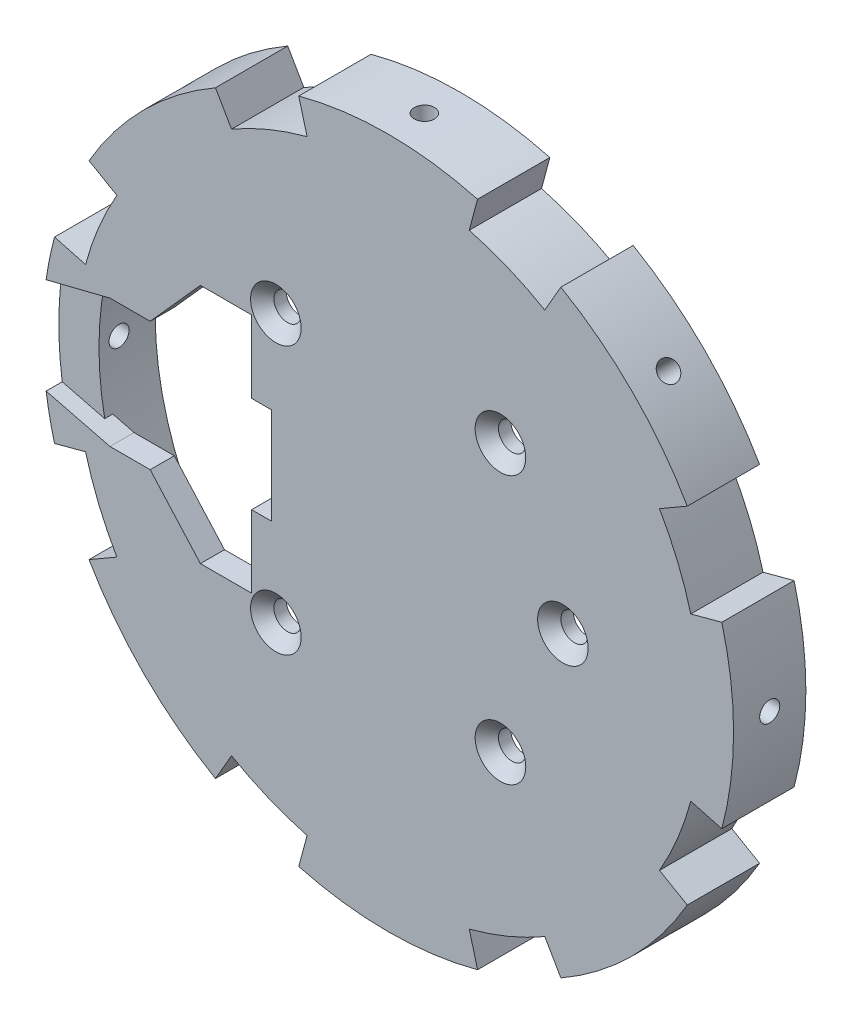
from build123d import *

# Parameters (mm, degrees)
SKETCH_1_R                   = 38
EXTRUDE_1_DEPTH              = 6
EXTRUDE_START                = 3
EXTRUDE_2_DEPTH              = 3
HOLE_WIZARD_M3_1_D           = 3.4
HOLE_WIZARD_M3_1_CSINK_D     = 6.3
HOLE_WIZARD_M3_1_CSINK_ANGLE = 90
M3X0_5_1_D                   = 2.5
M3X0_5_1_ON_FACE_2_D         = 2.5
M3X0_5_1_ON_FACE_3_D         = 2.5
M3X0_5_1_ON_FACE_4_D         = 2.5
M3X0_5_1_ON_FACE_5_D         = 2.5
M3X0_5_1_ON_FACE_6_D         = 2.5
M3X0_5_1_ON_FACE_7_D         = 2.5
M3X0_5_1_ON_FACE_8_D         = 2.5
CUT_EXTRUDE_START            = 3
CUT_EXTRUDE_1_DEPTH          = 3
EXTRUDE_START_2              = 1
EXTRUDE_3_DEPTH              = 1


with BuildPart() as part:
    # 草图1 → 凸台-拉伸1 (new body)
    with BuildSketch(Plane.XY):
        with BuildLine():
            Line((21.5, 37.239092363), (19.5, 33.774990748))
            ThreePointArc((19.5, 33.774990748), (14.924653862, 36.031301768), (10.093942759, 37.671107225))
            Line((10.093942759, 37.671107225), (11.129218939, 41.53481053))
            ThreePointArc((11.129218939, 41.53481053), (5.612626265, 42.632129039), (0, 43))
            ThreePointArc((0, 43), (-5.612626265, 42.632129039), (-11.129218939, 41.53481053))
            Line((-11.129218939, 41.53481053), (-10.093942759, 37.671107225))
            ThreePointArc((-10.093942759, 37.671107225), (-14.924653862, 36.031301768), (-19.5, 33.774990748))
            Line((-19.5, 33.774990748), (-21.5, 37.239092363))
            ThreePointArc((-21.5, 37.239092363), (-26.176741447, 34.114193633), (-30.405591591, 30.405591591))
            ThreePointArc((-30.405591591, 30.405591591), (-34.114193633, 26.176741447), (-37.239092363, 21.5))
            Line((-37.239092363, 21.5), (-33.774990748, 19.5))
            ThreePointArc((-33.774990748, 19.5), (-36.031301768, 14.924653862), (-37.671107225, 10.093942759))
            Line((-37.671107225, 10.093942759), (-41.53481053, 11.129218939))
            ThreePointArc((-41.53481053, 11.129218939), (-42.632129039, 5.612626265), (-43, 0))
            ThreePointArc((-43, 0), (-42.632129039, -5.612626265), (-41.53481053, -11.129218939))
            Line((-41.53481053, -11.129218939), (-37.671107225, -10.093942759))
            ThreePointArc((-37.671107225, -10.093942759), (-36.031301768, -14.924653862), (-33.774990748, -19.5))
            Line((-33.774990748, -19.5), (-37.239092363, -21.5))
            ThreePointArc((-37.239092363, -21.5), (-34.114193633, -26.176741447), (-30.405591591, -30.405591591))
            ThreePointArc((-30.405591591, -30.405591591), (-26.176741447, -34.114193633), (-21.5, -37.239092363))
            Line((-21.5, -37.239092363), (-19.5, -33.774990748))
            ThreePointArc((-19.5, -33.774990748), (-14.924653862, -36.031301768), (-10.093942759, -37.671107225))
            Line((-10.093942759, -37.671107225), (-11.129218939, -41.53481053))
            ThreePointArc((-11.129218939, -41.53481053), (-5.612626265, -42.632129039), (0, -43))
            ThreePointArc((0, -43), (5.612626265, -42.632129039), (11.129218939, -41.53481053))
            Line((11.129218939, -41.53481053), (10.093942759, -37.671107225))
            ThreePointArc((10.093942759, -37.671107225), (14.924653862, -36.031301768), (19.5, -33.774990748))
            Line((19.5, -33.774990748), (21.5, -37.239092363))
            ThreePointArc((21.5, -37.239092363), (26.176741447, -34.114193633), (30.405591591, -30.405591591))
            ThreePointArc((30.405591591, -30.405591591), (34.114193633, -26.176741447), (37.239092363, -21.5))
            Line((37.239092363, -21.5), (33.774990748, -19.5))
            ThreePointArc((33.774990748, -19.5), (36.031301768, -14.924653862), (37.671107225, -10.093942759))
            Line((37.671107225, -10.093942759), (41.53481053, -11.129218939))
            ThreePointArc((41.53481053, -11.129218939), (42.632129039, -5.612626265), (43, 0))
            ThreePointArc((43, 0), (42.632129039, 5.612626265), (41.53481053, 11.129218939))
            Line((41.53481053, 11.129218939), (37.671107225, 10.093942759))
            ThreePointArc((37.671107225, 10.093942759), (36.031301768, 14.924653862), (33.774990748, 19.5))
            Line((33.774990748, 19.5), (37.239092363, 21.5))
            ThreePointArc((37.239092363, 21.5), (34.114193633, 26.176741447), (30.405591591, 30.405591591))
            ThreePointArc((30.405591591, 30.405591591), (26.176741447, 34.114193633), (21.5, 37.239092363))
        make_face()
        Circle(SKETCH_1_R, mode=Mode.SUBTRACT)
    extrude(amount=-EXTRUDE_1_DEPTH)

    # 草图2 → 凸台-拉伸2 (add)
    with BuildSketch(Plane.XY.offset(EXTRUDE_START)):
        with BuildLine():
            Line((-11.129218939, 41.53481053), (-10.093942759, 37.671107225))
            ThreePointArc((-10.093942759, 37.671107225), (-14.924653862, 36.031301768), (-19.5, 33.774990748))
            Line((-19.5, 33.774990748), (-21.5, 37.239092363))
            ThreePointArc((-21.5, 37.239092363), (-26.176741447, 34.114193633), (-30.405591591, 30.405591591))
            ThreePointArc((-30.405591591, 30.405591591), (-34.114193633, 26.176741447), (-37.239092363, 21.5))
            Line((-37.239092363, 21.5), (-33.774990748, 19.5))
            ThreePointArc((-33.774990748, 19.5), (-36.031301768, 14.924653862), (-37.671107225, 10.093942759))
            Line((-37.671107225, 10.093942759), (-41.53481053, 11.129218939))
            ThreePointArc((-41.53481053, 11.129218939), (-42.632129039, 5.612626265), (-43, 0))
            ThreePointArc((-43, 0), (-42.632129039, -5.612626265), (-41.53481053, -11.129218939))
            Line((-41.53481053, -11.129218939), (-37.671107225, -10.093942759))
            ThreePointArc((-37.671107225, -10.093942759), (-36.031301768, -14.924653862), (-33.774990748, -19.5))
            Line((-33.774990748, -19.5), (-37.239092363, -21.5))
            ThreePointArc((-37.239092363, -21.5), (-34.114193633, -26.176741447), (-30.405591591, -30.405591591))
            ThreePointArc((-30.405591591, -30.405591591), (-26.176741447, -34.114193633), (-21.5, -37.239092363))
            Line((-21.5, -37.239092363), (-19.5, -33.774990748))
            ThreePointArc((-19.5, -33.774990748), (-14.924653862, -36.031301768), (-10.093942759, -37.671107225))
            Line((-10.093942759, -37.671107225), (-11.129218939, -41.53481053))
            ThreePointArc((-11.129218939, -41.53481053), (-5.612626265, -42.632129039), (0, -43))
            ThreePointArc((0, -43), (5.612626265, -42.632129039), (11.129218939, -41.53481053))
            Line((11.129218939, -41.53481053), (10.093942759, -37.671107225))
            ThreePointArc((10.093942759, -37.671107225), (14.924653862, -36.031301768), (19.5, -33.774990748))
            Line((19.5, -33.774990748), (21.5, -37.239092363))
            ThreePointArc((21.5, -37.239092363), (26.176741447, -34.114193633), (30.405591591, -30.405591591))
            ThreePointArc((30.405591591, -30.405591591), (34.114193633, -26.176741447), (37.239092363, -21.5))
            Line((37.239092363, -21.5), (33.774990748, -19.5))
            ThreePointArc((33.774990748, -19.5), (36.031301768, -14.924653862), (37.671107225, -10.093942759))
            Line((37.671107225, -10.093942759), (41.53481053, -11.129218939))
            ThreePointArc((41.53481053, -11.129218939), (42.632129039, -5.612626265), (43, 0))
            ThreePointArc((43, 0), (42.632129039, 5.612626265), (41.53481053, 11.129218939))
            Line((41.53481053, 11.129218939), (37.671107225, 10.093942759))
            ThreePointArc((37.671107225, 10.093942759), (36.031301768, 14.924653862), (33.774990748, 19.5))
            Line((33.774990748, 19.5), (37.239092363, 21.5))
            ThreePointArc((37.239092363, 21.5), (34.114193633, 26.176741447), (30.405591591, 30.405591591))
            ThreePointArc((30.405591591, 30.405591591), (26.176741447, 34.114193633), (21.5, 37.239092363))
            Line((21.5, 37.239092363), (19.5, 33.774990748))
            ThreePointArc((19.5, 33.774990748), (14.924653862, 36.031301768), (10.093942759, 37.671107225))
            Line((10.093942759, 37.671107225), (11.129218939, 41.53481053))
            ThreePointArc((11.129218939, 41.53481053), (5.612626265, 42.632129039), (0, 43))
            ThreePointArc((0, 43), (-5.612626265, 42.632129039), (-11.129218939, 41.53481053))
        make_face()
    extrude(amount=-EXTRUDE_2_DEPTH)

    # M3 锥坑平头的锥孔1 (through all)
    with Locations(Plane(origin=(13.98063051, -16.66146664, 3), x_dir=(1, 0, 0), z_dir=(0, 0, 1))):
        with Locations((0, 0), (7.76936949, 16.66146664), (0, 33.32293328), (-27.96126102, 0), (-35.73063051, 16.66146664), (-27.96126102, 33.32293328)):
            CounterSinkHole(HOLE_WIZARD_M3_1_D / 2, HOLE_WIZARD_M3_1_CSINK_D / 2, counter_sink_angle=HOLE_WIZARD_M3_1_CSINK_ANGLE)

    # M3x0.5 螺纹孔1 (through all)
    with Locations(Plane(origin=(0, -43, -1.5), x_dir=(-1, 0, 0), z_dir=(0, -1, 0))):
        with Locations((0, 0)):
            Hole(M3X0_5_1_D / 2)

    # M3x0.5 螺纹孔1 on face 2 (through all)
    with Locations(Plane(origin=(30.405591591, -30.405591591, -1.5), x_dir=(-0.707106781187, -0.707106781187, 0), z_dir=(0.707106781187, -0.707106781187, 0))):
        with Locations((0, 0)):
            Hole(M3X0_5_1_ON_FACE_2_D / 2)

    # M3x0.5 螺纹孔1 on face 3 (through all)
    with Locations(Plane(origin=(30.405591592, 30.40559159, -1.5), x_dir=(0.707106781187, -0.707106781187, 0), z_dir=(0.707106781187, 0.707106781187, 0))):
        with Locations((0, 0)):
            Hole(M3X0_5_1_ON_FACE_3_D / 2)

    # M3x0.5 螺纹孔1 on face 4 (through all)
    with Locations(Plane(origin=(43, 0, -1.5), x_dir=(0, 0, 1), z_dir=(1, 0, 0))):
        with Locations((0, 0)):
            Hole(M3X0_5_1_ON_FACE_4_D / 2)

    # M3x0.5 螺纹孔1 on face 5 (through all)
    with Locations(Plane(origin=(-30.405591591, 30.405591591, -1.5), x_dir=(0.707106781187, 0.707106781187, 0), z_dir=(-0.707106781187, 0.707106781187, 0))):
        with Locations((0, 0)):
            Hole(M3X0_5_1_ON_FACE_5_D / 2)

    # M3x0.5 螺纹孔1 on face 6 (through all)
    with Locations(Plane(origin=(-30.40559159, -30.405591592, -1.5), x_dir=(-0.707106781187, 0.707106781187, 0), z_dir=(-0.707106781187, -0.707106781187, 0))):
        with Locations((0, 0)):
            Hole(M3X0_5_1_ON_FACE_6_D / 2)

    # M3x0.5 螺纹孔1 on face 7 (through all)
    with Locations(Plane(origin=(-43, 0, -1.5), x_dir=(0, 0, -1), z_dir=(-1, 0, 0))):
        with Locations((0, 0)):
            Hole(M3X0_5_1_ON_FACE_7_D / 2)

    # M3x0.5 螺纹孔1 on face 8 (through all)
    with Locations(Plane(origin=(0, 43, -1.5), x_dir=(0, 0, 1), z_dir=(0, 1, 0))):
        with Locations((0, 0)):
            Hole(M3X0_5_1_ON_FACE_8_D / 2)

    # 草图6 → 切除-拉伸1 (cut)
    with BuildSketch(Plane.XY.offset(CUT_EXTRUDE_START)):
        with BuildLine():
            Line((-14.5, -6), (-14.5, 6))
            Line((-14.5, 6), (-17, 6))
            Line((-17, 6), (-17, 15))
            Line((-17, 15), (-23.37462575, 15))
            Line((-23.37462575, 15), (-29.624630174, 8))
            Line((-29.624630174, 8), (-34.624630174, 8))
            Line((-34.624630174, 8), (-42.579337712, 6))
            ThreePointArc((-42.579337712, 6), (-43, 0), (-42.579337712, -6))
            Line((-42.579337712, -6), (-34.624630174, -8))
            Line((-34.624630174, -8), (-29.624630174, -8))
            Line((-29.624630174, -8), (-23.37462575, -15))
            Line((-23.37462575, -15), (-17, -15))
            Line((-17, -15), (-17, -6))
            Line((-17, -6), (-14.5, -6))
        make_face()
    extrude(amount=-CUT_EXTRUDE_1_DEPTH, mode=Mode.SUBTRACT)

    # 草图9 → 凸台-拉伸3 (add)
    with BuildSketch(Plane.XY.offset(EXTRUDE_START_2)):
        with BuildLine():
            Line((-42.579337712, 6), (-37.286177193, 7.330824671))
            ThreePointArc((-37.286177193, 7.330824671), (-38, 0), (-37.286177193, -7.330824671))
            Line((-37.286177193, -7.330824671), (-42.579337712, -6))
            ThreePointArc((-42.579337712, -6), (-43, 0), (-42.579337712, 6))
        make_face()
    extrude(amount=-EXTRUDE_3_DEPTH)


solid = part.part
